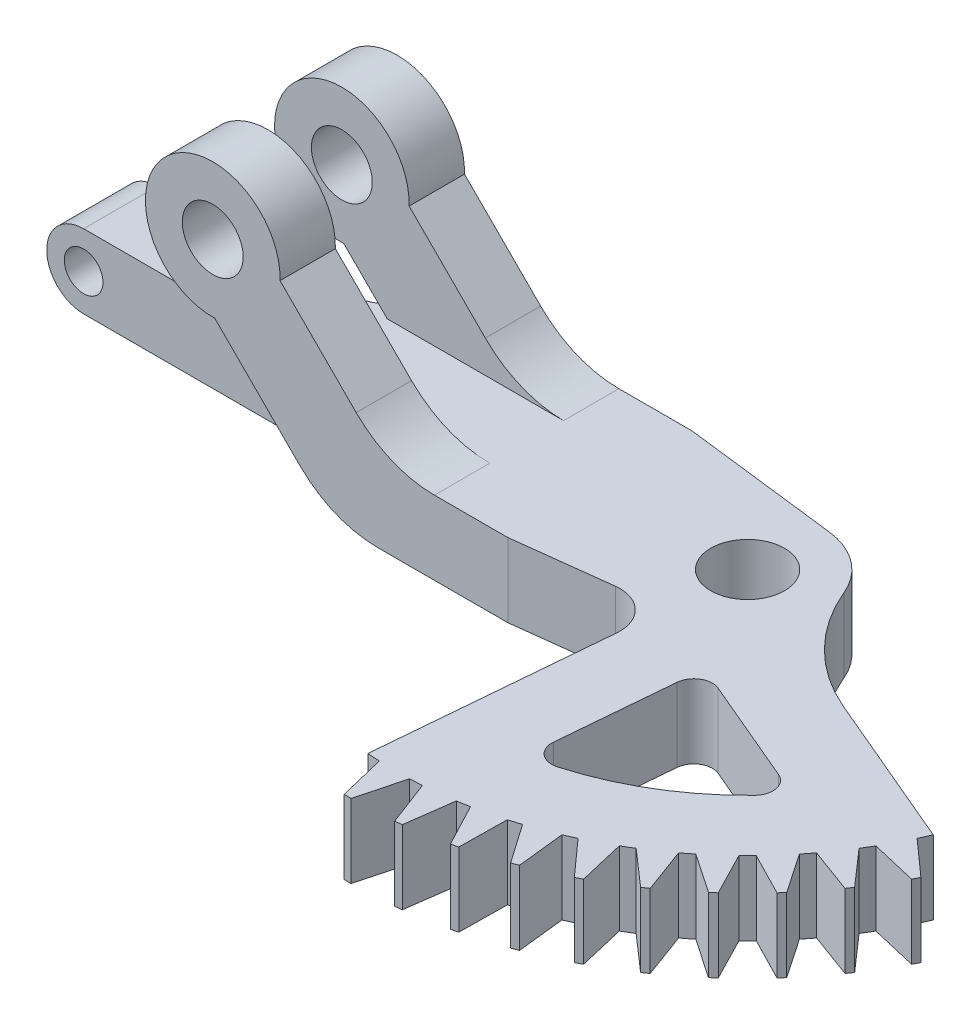
from build123d import *

# Parameters (mm, degrees)
SKETCH1_R           = 1.6500000000000001
BOSS_EXTRUDE1_DEPTH = 5
CUT_EXTRUDE1_DEPTH  = 22.617643257302586
SKETCH4_R           = 2.000000000000003
BOSS_EXTRUDE2_DEPTH = 4
SKETCH5_R           = 1.0500000000000005
BOSS_EXTRUDE3_DEPTH = 2
CUT_EXTRUDE2_REACH  = 52.658
CIRPATTERN1_COUNT   = 11
CIRPATTERN1_ANGLE   = 70.00000000000016
CUT_EXTRUDE3_DEPTH  = 4
FILLET1_R           = 6
FILLET2_R           = 2
CUT_EXTRUDE4_REACH  = 51.172


with BuildPart() as part:
    # Sketch1 → Boss-Extrude1 (new, symmetric)
    with BuildSketch(Plane.XY):
        with BuildLine():
            Line((6.464466094067297, -10), (16, -10))
            Line((16, -10), (16, -5.999999999999998))
            Line((16, -5.999999999999998), (9.535533905932775, -5.999999999999998))
            Line((9.535533905932775, -5.999999999999998), (3.6482589098755183, -0.11272500394276944))
            ThreePointArc((3.6482589098755183, -0.11272500394276944), (-2.580939751330903, 2.5809397513308943), (0.11272500394278592, -3.6482589098755174))
            Line((0.11272500394278592, -3.6482589098755174), (6.464466094067297, -10))
        make_face()
        Circle(SKETCH1_R, mode=Mode.SUBTRACT)
    extrude(amount=BOSS_EXTRUDE1_DEPTH, both=True)

    # Sketch3 → Cut-Extrude1 (cut, through all)
    with BuildSketch(Plane.XZ.offset(10)):
        Polygon((6.464466094067297, 2.000000000000001), (-3.6500000000000012, 1.9999999999999996), (-3.650000000000001, -2.0000000000000004), (6.464466094067298, -1.9999999999999991), align=None)
    extrude(amount=-CUT_EXTRUDE1_DEPTH, mode=Mode.SUBTRACT)

    # Sketch4 → Boss-Extrude2 (add)
    with BuildSketch(Plane.XZ.offset(10)):
        with BuildLine():
            Line((16, 5), (16, -5))
            Line((16, -5), (21.19546555409763, -4.369618467658506))
            Line((21.19546555409763, -4.369618467658506), (24.481798594453377, -3.970877751125406))
            ThreePointArc((24.481798594453377, -3.970877751125406), (26.41654324887739, -3.187525486377344), (27.693251449070946, -1.5361945625263))
            ThreePointArc((27.693251449070946, -1.5361945625263), (29.829731429750588, 1.668713133124987), (33.01906878685553, 3.8283675656823353))
            Line((33.01906878685553, 3.8283675656823353), (43.79085434922743, 8.400719262519475))
            ThreePointArc((43.79085434922743, 8.400719262519475), (35.07331861056618, 18.429096965095408), (22.126151530925494, 21.418186008972544))
            Line((22.126151530925494, 21.418186008972544), (23.428754247507808, 6.529368828716514))
            ThreePointArc((23.428754247507808, 6.529368828716514), (22.82671005925236, 4.917371632507108), (21.19546555409763, 4.369618467658506))
            Line((21.19546555409763, 4.369618467658506), (16, 5))
        make_face()
        with Locations(Location((24, 0, 0), (0, 0, 270))):
            Circle(SKETCH4_R, mode=Mode.SUBTRACT)
    extrude(amount=-BOSS_EXTRUDE2_DEPTH)

    # Sketch5 → Boss-Extrude3 (add, symmetric)
    with BuildSketch(Plane.XY):
        with BuildLine():
            Line((6.464466094067297, -10), (-10, -10.000000000000002))
            ThreePointArc((-10, -10.000000000000002), (-11.999999999999998, -8), (-9.999999999999998, -6.000000000000002))
            Line((-9.999999999999998, -6.000000000000002), (9.535533905932775, -5.999999999999998))
            Line((9.535533905932775, -5.999999999999998), (16, -5.999999999999998))
            Line((16, -5.999999999999998), (16, -10))
            Line((16, -10), (6.464466094067297, -10))
        make_face()
        with Locations((-9.999999999999998, -8.000000000000002)):
            Circle(SKETCH5_R, mode=Mode.SUBTRACT)
    extrude(amount=BOSS_EXTRUDE3_DEPTH, both=True)

    # Sketch6 → Cut-Extrude2 (cut, up to next)
    with BuildSketch(Plane.XZ.offset(10), mode=Mode.PRIVATE) as cut_extrude2_sk1:
        with BuildLine():
            Line((41.21984795369632, 8.029746973073365), (43.15664027004987, 9.760795744400328))
            ThreePointArc((43.15664027004987, 9.760795744400328), (43.324071995432064, 9.424979655965245), (43.48561742128794, 9.086292627425122))
            ThreePointArc((43.48561742128794, 9.086292627425122), (43.64122733931588, 8.744837826129787), (43.79085434922743, 8.40071926251947))
            ThreePointArc((43.79085434922743, 8.40071926251947), (43.93445287318589, 8.054041758442194), (44.071979169689804, 7.704910915224042))
            Line((44.071979169689804, 7.704910915224042), (41.48959221559633, 7.42389144129628))
            ThreePointArc((41.48959221559633, 7.42389144129628), (41.357363695209386, 7.72799621844028), (41.21984795369632, 8.029746973073365))
        make_face()
    cut_extrude2_tool1 = extrude(cut_extrude2_sk1.sketch, amount=-CUT_EXTRUDE2_REACH, mode=Mode.PRIVATE) & part.part
    cut_extrude2 = cut_extrude2_tool1.solids().sort_by_distance((42.701484, -10, 8.326437))[0]
    add(cut_extrude2, mode=Mode.SUBTRACT)

    # CirPattern1: Cut-Extrude2; each copy of Cut-Extrude2 runs up to whatever stops it at its own place
    cirpattern1_before = part.part  # the part as the pattern finds it: every copy runs up to it
    cirpattern1_cut_extrude2_long = extrude(cut_extrude2_sk1.sketch, amount=-CUT_EXTRUDE2_REACH, mode=Mode.PRIVATE)
    cirpattern1_cut_extrude2_tool1 = cirpattern1_cut_extrude2_long.rotate(Axis((24.000000000000014, 0, -2.52e-15), (0, -1, 0)), 1 * CIRPATTERN1_ANGLE / (CIRPATTERN1_COUNT - 1)) & cirpattern1_before
    add(cirpattern1_cut_extrude2_tool1.solids().sort_by_distance((41.547349, -10, 10.543511))[0], mode=Mode.SUBTRACT)
    cirpattern1_cut_extrude2_tool2 = cirpattern1_cut_extrude2_long.rotate(Axis((24.000000000000014, 0, -2.52e-15), (0, -1, 0)), 2 * CIRPATTERN1_ANGLE / (CIRPATTERN1_COUNT - 1)) & cirpattern1_before
    add(cirpattern1_cut_extrude2_tool2.solids().sort_by_distance((40.131623, -10, 12.603405))[0], mode=Mode.SUBTRACT)
    cirpattern1_cut_extrude2_tool3 = cirpattern1_cut_extrude2_long.rotate(Axis((24.000000000000014, 0, -2.52e-15), (0, -1, 0)), 3 * CIRPATTERN1_ANGLE / (CIRPATTERN1_COUNT - 1)) & cirpattern1_before
    add(cirpattern1_cut_extrude2_tool3.solids().sort_by_distance((38.475411, -10, 14.475411))[0], mode=Mode.SUBTRACT)
    cirpattern1_cut_extrude2_tool4 = cirpattern1_cut_extrude2_long.rotate(Axis((24.000000000000014, 0, -2.52e-15), (0, -1, 0)), 4 * CIRPATTERN1_ANGLE / (CIRPATTERN1_COUNT - 1)) & cirpattern1_before
    add(cirpattern1_cut_extrude2_tool4.solids().sort_by_distance((36.603405, -10, 16.131622))[0], mode=Mode.SUBTRACT)
    cirpattern1_cut_extrude2_tool5 = cirpattern1_cut_extrude2_long.rotate(Axis((24.000000000000014, 0, -2.52e-15), (0, -1, 0)), 5 * CIRPATTERN1_ANGLE / (CIRPATTERN1_COUNT - 1)) & cirpattern1_before
    add(cirpattern1_cut_extrude2_tool5.solids().sort_by_distance((34.543511, -10, 17.547348))[0], mode=Mode.SUBTRACT)
    cirpattern1_cut_extrude2_tool6 = cirpattern1_cut_extrude2_long.rotate(Axis((24.000000000000014, 0, -2.52e-15), (0, -1, 0)), 6 * CIRPATTERN1_ANGLE / (CIRPATTERN1_COUNT - 1)) & cirpattern1_before
    add(cirpattern1_cut_extrude2_tool6.solids().sort_by_distance((32.326437, -10, 18.701484))[0], mode=Mode.SUBTRACT)
    cirpattern1_cut_extrude2_tool7 = cirpattern1_cut_extrude2_long.rotate(Axis((24.000000000000014, 0, -2.52e-15), (0, -1, 0)), 7 * CIRPATTERN1_ANGLE / (CIRPATTERN1_COUNT - 1)) & cirpattern1_before
    add(cirpattern1_cut_extrude2_tool7.solids().sort_by_distance((29.985236, -10, 19.576823))[0], mode=Mode.SUBTRACT)
    cirpattern1_cut_extrude2_tool8 = cirpattern1_cut_extrude2_long.rotate(Axis((24.000000000000014, 0, -2.52e-15), (0, -1, 0)), 8 * CIRPATTERN1_ANGLE / (CIRPATTERN1_COUNT - 1)) & cirpattern1_before
    add(cirpattern1_cut_extrude2_tool8.solids().sort_by_distance((27.554808, -10, 20.160317))[0], mode=Mode.SUBTRACT)
    cirpattern1_cut_extrude2_tool9 = cirpattern1_cut_extrude2_long.rotate(Axis((24.000000000000014, 0, -2.52e-15), (0, -1, 0)), 9 * CIRPATTERN1_ANGLE / (CIRPATTERN1_COUNT - 1)) & cirpattern1_before
    add(cirpattern1_cut_extrude2_tool9.solids().sort_by_distance((25.071386, -10, 20.443268))[0], mode=Mode.SUBTRACT)
    cirpattern1_cut_extrude2_tool10 = cirpattern1_cut_extrude2_long.rotate(Axis((24.000000000000014, 0, -2.52e-15), (0, -1, 0)), 10 * CIRPATTERN1_ANGLE / (CIRPATTERN1_COUNT - 1)) & cirpattern1_before
    add(cirpattern1_cut_extrude2_tool10.solids().sort_by_distance((22.571993, -10, 20.421456))[0], mode=Mode.SUBTRACT)

    # Sketch7 → Cut-Extrude3 (cut)
    with BuildSketch(Plane(origin=(0, -5.999999999999998, 0), x_dir=(1, 0, 0), z_dir=(0, 1, 0))):
        Polygon((9.535533905932775, -2.0000000000000013), (6.464466094067297, -2.000000000000001), (6.464466094067298, 1.9999999999999991), (9.535533905932775, 1.9999999999999991), align=None)
    extrude(amount=CUT_EXTRUDE3_DEPTH, mode=Mode.SUBTRACT)

    # Fillet1
    fillet1_edges = [part.edges().sort_by_distance(p)[0] for p in [
        (6.464466094067297, -10, 3.5),
        (9.535533905932775, -5.999999999999998, 3.5),
        (6.464466094067297, -10, -3.4999999999999996),
        (9.535533905932775, -5.999999999999998, -3.5),
    ]]
    fillet(fillet1_edges, radius=FILLET1_R)

    # Fillet2
    # the kernel refuses this fillet: 2 mm, written as the material it adds along each edge
    with BuildSketch(Plane(origin=(-1.0710678118654662, -2.4644660940672707, -2), x_dir=(1.2e-16, -1e-17, -1), z_dir=(0.7071067811865491, -0.707106781186546, 0))) as fillet2_piece_1_section:
        with BuildLine():
            CenterArc((FILLET2_R, -FILLET2_R), FILLET2_R, 90, 90)
            Line((-1.6e-16, -FILLET2_R), (0, 0))
            Line((0, 0), (FILLET2_R, 0))
        make_face()
    fillet2_piece_1 = extrude(amount=8.171572875253831, mode=Mode.PRIVATE)
    fillet2_piece_1 = split(fillet2_piece_1, bisect_by=Plane(origin=(3.0707262538263027, -5.999999999999999, -2.423870706471317), z_dir=(1.8e-16, -1, 0)), keep=Keep.TOP, mode=Mode.PRIVATE)
    add(fillet2_piece_1)
    with BuildSketch(Plane(origin=(8.94974746830586, -3.999999999999999, -2), x_dir=(-0.7071067811865458, -0.7071067811865492, 0), z_dir=(-0.7071067811865492, 0.7071067811865458, 0))) as fillet2_piece_2_section:
        with BuildLine():
            CenterArc((6 + FILLET2_R, -FILLET2_R), FILLET2_R, 90, 90)
            Line((6 + FILLET2_R, 0), (6, 0))
            Line((6, 0), (6.000000000000001, -FILLET2_R))
        make_face()
    fillet2_piece_2 = revolve(axis=Axis((8.94974746830586, -3.999999999999999, -2), (0, 0, 1)), revolution_arc=92.75127695444853, mode=Mode.PRIVATE)
    fillet2_piece_2 = split(fillet2_piece_2, bisect_by=Plane(origin=(6.6265116676217675, -10, -2.6906159544544805), z_dir=(0, 1, 0)), keep=Keep.TOP, mode=Mode.PRIVATE)
    add(fillet2_piece_2)
    with BuildSketch(Plane(origin=(8.94974746830586, -3.999999999999999, 2), x_dir=(-0.7071067811865458, -0.7071067811865492, 0), z_dir=(-0.7071067811865492, 0.7071067811865458, 0))) as fillet2_piece_3_section:
        with BuildLine():
            CenterArc((6 + FILLET2_R, FILLET2_R), FILLET2_R, 180, 90)
            Line((6 + FILLET2_R, 0), (6, 0))
            Line((6, 0), (6.000000000000001, FILLET2_R))
        make_face()
    fillet2_piece_3 = revolve(axis=Axis((8.94974746830586, -3.999999999999999, 2), (0, 0, 1)), revolution_arc=92.75127695444853, mode=Mode.PRIVATE)
    fillet2_piece_3 = split(fillet2_piece_3, bisect_by=Plane(origin=(6.626511667621772, -10, 2.6906159544544797), z_dir=(0, 1, 0)), keep=Keep.TOP, mode=Mode.PRIVATE)
    add(fillet2_piece_3)
    with BuildSketch(Plane(origin=(4.707106781186583, -8.242640687119295, 2.0000000000000004), x_dir=(1.6e-16, 2.9e-16, 1), z_dir=(-0.7071067811865491, 0.707106781186546, 0))) as fillet2_piece_4_section:
        with BuildLine():
            CenterArc((FILLET2_R, -FILLET2_R), FILLET2_R, 89.99999999999999, 90.00000000000001)
            Line((-1.07e-15, -FILLET2_R), (0, 0))
            Line((0, 0), (FILLET2_R, 0))
        make_face()
    fillet2_piece_4 = extrude(amount=8.171572875253833, mode=Mode.PRIVATE)
    fillet2_piece_4 = split(fillet2_piece_4, bisect_by=Plane(origin=(3.0707262538259545, -5.999999999999999, 2.4238707064714085), z_dir=(1.8e-16, -1, 0)), keep=Keep.TOP, mode=Mode.PRIVATE)
    add(fillet2_piece_4)

    # Sketch8 → Cut-Extrude4 (cut, up to next)
    with BuildSketch(Plane(origin=(0, -5.999999999999998, 0), x_dir=(1, 0, 0), z_dir=(0, 1, 0)), mode=Mode.PRIVATE) as cut_extrude4_sk1:
        with BuildLine():
            ThreePointArc((28.115640284464295, -14.42433724816827), (31.725571123650823, -12.857509510531676), (34.803757775643525, -10.405710832289252))
            ThreePointArc((34.803757775643525, -10.405710832289252), (35.06330097352167, -9.511986093117567), (34.47423838575658, -8.791491923350865))
            Line((34.47423838575658, -8.791491923350865), (28.771906676032494, -6.370995718899502))
            ThreePointArc((28.771906676032494, -6.370995718899502), (27.866137472633152, -6.434333271649826), (27.38498084945146, -7.2043448296042945))
            Line((27.38498084945146, -7.2043448296042945), (26.845069567408263, -13.375559022209401))
            ThreePointArc((26.845069567408263, -13.375559022209401), (27.20468002661588, -14.23392193997834), (28.115640284464295, -14.42433724816827))
        make_face()
    cut_extrude4_tool1 = extrude(cut_extrude4_sk1.sketch, amount=-CUT_EXTRUDE4_REACH, mode=Mode.PRIVATE) & part.part
    add(cut_extrude4_tool1.solids().sort_by_distance((30.212176, -6, 10.338796))[0], mode=Mode.SUBTRACT)


solid = part.part
